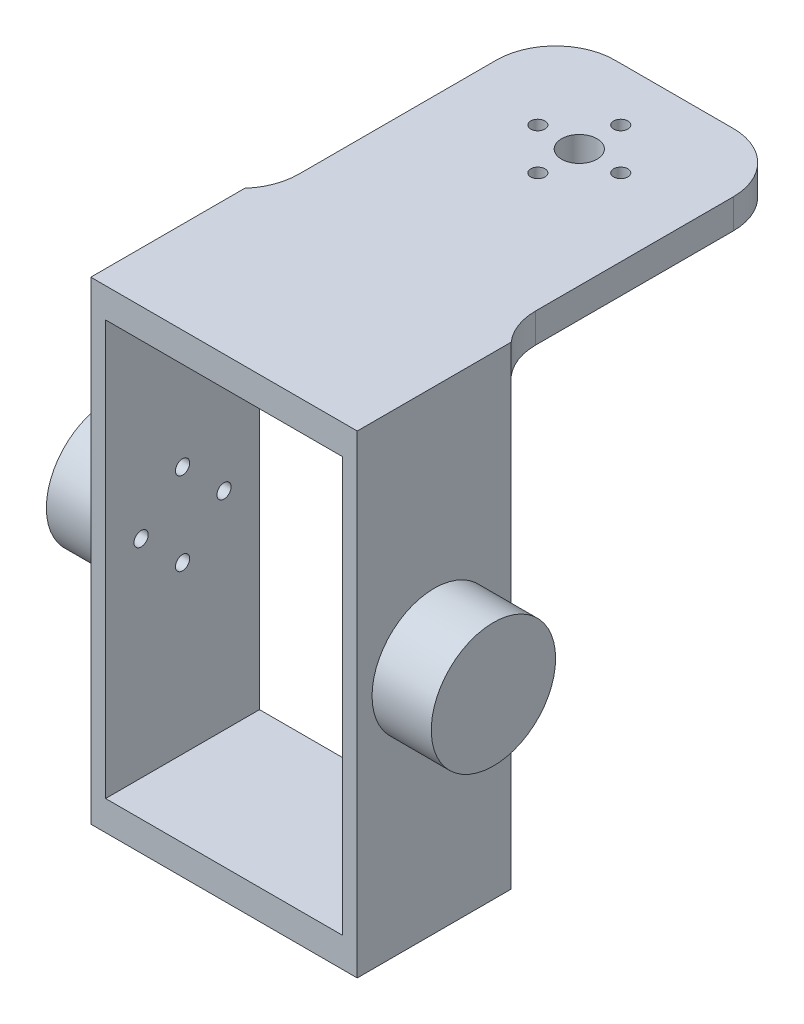
from build123d import *

# Parameters (mm, degrees)
SKETCH1_W           = 45
SKETCH1_H           = 26
BOSS_EXTRUDE1_DEPTH = 5
SKETCH2_W           = 2.5
SKETCH2_H           = 26
BOSS_EXTRUDE2_DEPTH = 70
LPATTERN2_COUNT     = 2
LPATTERN2_PITCH     = 42.5
SKETCH3_W           = 45
SKETCH3_H           = 26
BOSS_EXTRUDE3_DEPTH = 5
SKETCH7_R           = 10.5
BOSS_EXTRUDE5_DEPTH = 10
LPATTERN3_COUNT     = 2
LPATTERN3_PITCH     = 50
CUT_EXTRUDE1_REACH  = 105.325
SKETCH8_R           = 1.2
CIRPATTERN1_COUNT   = 4
SKETCH9_R           = 3
CUT_EXTRUDE2_DEPTH  = 2
BOSS_EXTRUDE6_START = 5
SKETCH10_R          = 10.5
BOSS_EXTRUDE6_DEPTH = 5
SKETCH11_W          = 40
SKETCH11_H          = 5
BOSS_EXTRUDE7_DEPTH = 50
FILLET1_R           = 10
SKETCH12_R          = 3
SKETCH12_R_2        = 1.2
CUT_EXTRUDE3_DEPTH  = 50
CIRPATTERN2_COUNT   = 4


with BuildPart() as part:
    # Sketch1 → Boss-Extrude1 (new body)
    with BuildSketch(Plane(origin=(0, 0, 0), x_dir=(1, 0, 0), z_dir=(0, 1, 0))):
        with Locations((22.5, 13)):
            Rectangle(SKETCH1_W, SKETCH1_H)
    extrude(amount=BOSS_EXTRUDE1_DEPTH)

    # Sketch2 → Boss-Extrude2 (add)
    with BuildSketch(Plane(origin=(0, 5, 0), x_dir=(1, 0, 0), z_dir=(0, 1, 0))):
        with Locations((1.25, 13)):
            Rectangle(SKETCH2_W, SKETCH2_H)
    boss_extrude2 = extrude(amount=BOSS_EXTRUDE2_DEPTH)

    # LPattern2: Boss-Extrude2 ×2
    with Locations(*[(i * LPATTERN2_PITCH, 0, 0) for i in range(1, LPATTERN2_COUNT)]):
        add(boss_extrude2)

    # Sketch3 → Boss-Extrude3 (add)
    with BuildSketch(Plane(origin=(0, 75, 0), x_dir=(1, 0, 0), z_dir=(0, 1, 0))):
        with Locations((22.5, 13)):
            Rectangle(SKETCH3_W, SKETCH3_H)
    extrude(amount=BOSS_EXTRUDE3_DEPTH)

    # Sketch7 → Boss-Extrude5 (add)
    with BuildSketch(Plane.ZY):
        with Locations((-13, 40)):
            Circle(SKETCH7_R)
    boss_extrude5 = extrude(amount=BOSS_EXTRUDE5_DEPTH)

    # LPattern3: Boss-Extrude5 ×2
    with Locations(*[(i * LPATTERN3_PITCH, 0, 0) for i in range(1, LPATTERN3_COUNT)]):
        add(boss_extrude5)

    # Sketch8 → Cut-Extrude1 (cut, up to next)
    with BuildSketch(Plane.ZY.offset(10), mode=Mode.PRIVATE) as cut_extrude1_sk1:
        with Locations((-13, 47)):
            Circle(SKETCH8_R)
    cut_extrude1_tool1 = extrude(cut_extrude1_sk1.sketch, amount=-CUT_EXTRUDE1_REACH, mode=Mode.PRIVATE) & part.part
    cut_extrude1 = cut_extrude1_tool1.solids().sort_by_distance((-10, 47, -13))[0]
    add(cut_extrude1, mode=Mode.SUBTRACT)

    # CirPattern1: Cut-Extrude1 ×4 about axis
    cirpattern1_axis = Axis((0, 40, -13), (1, 0, 0))
    for i in range(1, CIRPATTERN1_COUNT):
        add(cut_extrude1.rotate(cirpattern1_axis, i * 360 / CIRPATTERN1_COUNT), mode=Mode.SUBTRACT)

    # Sketch9 → Cut-Extrude2 (cut)
    with BuildSketch(Plane.ZY.offset(10)):
        with Locations((-13, 40)):
            Circle(SKETCH9_R)
    extrude(amount=-CUT_EXTRUDE2_DEPTH, mode=Mode.SUBTRACT)

    # Sketch10 → Boss-Extrude6 (add)
    with BuildSketch(Plane(origin=(50, 0, 0), x_dir=(0, 0, -1), z_dir=(1, 0, 0)).offset(BOSS_EXTRUDE6_START)):
        with Locations(Location((13, 40, 0), (0, 0, 180))):
            Circle(SKETCH10_R)
    extrude(amount=-BOSS_EXTRUDE6_DEPTH)

    # Sketch11 → Boss-Extrude7 (add)
    with BuildSketch(Plane(origin=(0, 0, -26), x_dir=(-1, 0, 0), z_dir=(0, 0, -1))):
        with Locations((-22.5, 77.5)):
            Rectangle(SKETCH11_W, SKETCH11_H)
    extrude(amount=BOSS_EXTRUDE7_DEPTH)

    # Fillet1
    # the kernel refuses this fillet: 10 mm, written as the material it adds along each edge
    with BuildSketch(Plane(origin=(2.5, 80, -26), x_dir=(-1, 0, 0), z_dir=(0, -1, 0)), Plane(origin=(42.5, 75, -26), x_dir=(1, 0, 0), z_dir=(0, 1, 0))) as fillet1_piece_1:
        with BuildLine():
            CenterArc((10, 6.614378278), FILLET1_R, 180, 41.409622109)
            Line((0, 6.614378278), (0, 0))
            Line((0, 0), (2.5, 0))
        make_face()
    extrude(amount=5)
    # the kernel refuses this fillet: 10 mm, written as the material it takes off along each edge
    with BuildSketch(Plane(origin=(2.5, 105, -76), x_dir=(0, 0, 1), z_dir=(0, -1, 0))) as fillet1_2_piece_1:
        with BuildLine():
            CenterArc((FILLET1_R, -FILLET1_R), FILLET1_R, 90, 90)
            Line((0, -FILLET1_R), (0, 0))
            Line((0, 0), (FILLET1_R, 0))
        make_face()
    extrude(amount=55, mode=Mode.SUBTRACT)
    with BuildSketch(Plane(origin=(42.5, 50, -76), x_dir=(-1, 0, 0), z_dir=(0, 1, 0))) as fillet1_2_piece_2:
        with BuildLine():
            CenterArc((FILLET1_R, FILLET1_R), FILLET1_R, 180, 90)
            Line((0, FILLET1_R), (0, 0))
            Line((0, 0), (FILLET1_R, 0))
        make_face()
    extrude(amount=55, mode=Mode.SUBTRACT)

    # Sketch12 → Cut-Extrude3 (cut)
    with BuildSketch(Plane(origin=(0, 80, 0), x_dir=(1, 0, 0), z_dir=(0, 1, 0))):
        with Locations(Location((22.5, 60, 0), (0, 0, 270))):
            Circle(SKETCH12_R)
        with Locations(Location((29.5, 60, 0), (0, 0, 270))):
            Circle(SKETCH12_R_2)
    cut_extrude3 = extrude(amount=-CUT_EXTRUDE3_DEPTH, mode=Mode.SUBTRACT)

    # CirPattern2: Cut-Extrude3 ×4 about axis
    cirpattern2_axis = Axis((22.5, 0, -60), (0, 1, 0))
    for i in range(1, CIRPATTERN2_COUNT):
        add(cut_extrude3.rotate(cirpattern2_axis, i * 360 / CIRPATTERN2_COUNT), mode=Mode.SUBTRACT)


solid = part.part
